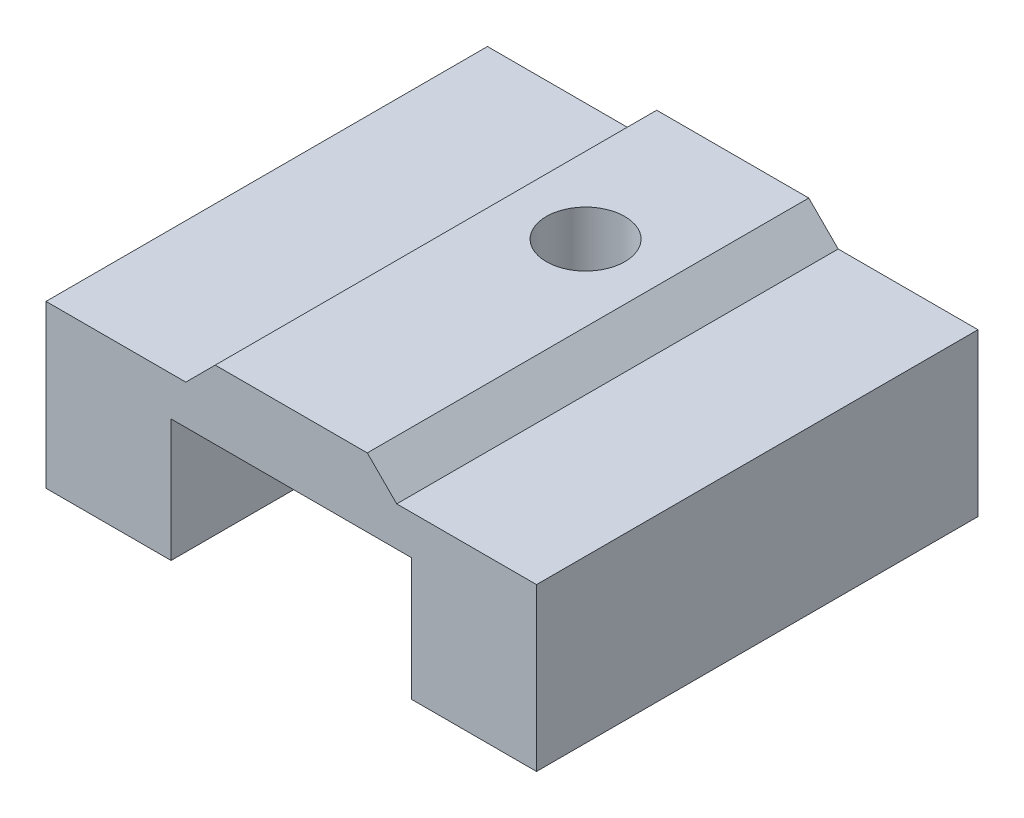
from build123d import *

# Parameters (mm, degrees)
BOSS_EXTRUDE2_DEPTH = 18
SKETCH3_R           = 1.6
CUT_EXTRUDE1_DEPTH  = 24
CHAMFER1_SIZE       = 1.2


with BuildPart() as part:
    # Sketch2 → Boss-Extrude2 (new body)
    with BuildSketch(Plane.XY):
        Polygon((-3.1, 0), (3.1, 0), (3.1, -1.2), (10, -1.2), (10, -7.8), (4.9, -7.8), (4.9, -2.8), (-4.9, -2.8), (-4.9, -7.8), (-10, -7.8), (-10, -1.2), (-3.1, -1.2), align=None)
    extrude(amount=BOSS_EXTRUDE2_DEPTH)

    # Sketch3 → Cut-Extrude1 (cut)
    with BuildSketch(Plane(origin=(0, 0, 0), x_dir=(1, 0, 0), z_dir=(0, 1, 0))):
        with Locations(Location((0, -6, 0), (0, 0, 270))):
            Circle(SKETCH3_R)
    extrude(amount=-CUT_EXTRUDE1_DEPTH, mode=Mode.SUBTRACT)

    # Chamfer1
    chamfer1_edges = [part.edges().sort_by_distance(p)[0] for p in [
        (3.1, -1.2, 9),
        (-3.1, -1.2, 9),
    ]]
    chamfer(chamfer1_edges, length=CHAMFER1_SIZE - 0.0001)  # a hair under: the kernel refuses the full size


solid = part.part
